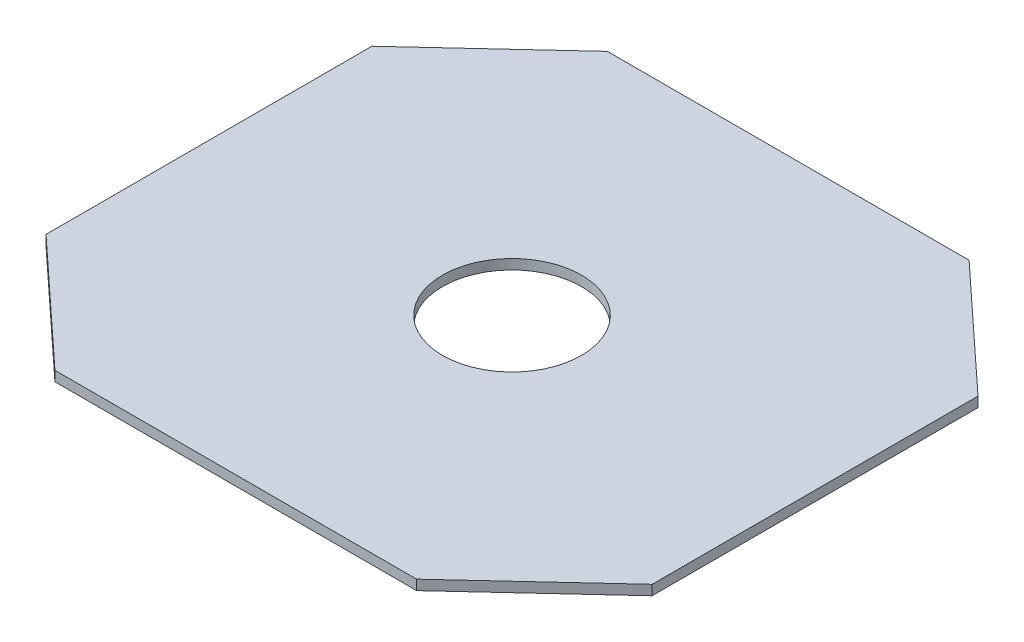
from build123d import *

# Parameters (mm, degrees)
SKETCH_1_R      = 35
EXTRUDE_1_DEPTH = 5


with BuildPart() as part:
    # Эскиз1 → Вытянуть1 (new body)
    with BuildSketch(Plane(origin=(0, 0, 0), x_dir=(1, 0, 0), z_dir=(0, 1, 0))):
        Polygon((-151.693051502, 77.916478726), (-151.693051502, -86.083521274), (-90.193051502, -143.083521274), (91.806948498, -143.083521274), (153.306948498, -86.083521274), (153.306948498, 77.916478726), (91.806948498, 134.916478726), (-90.193051502, 134.916478726), align=None)
        with Locations((0.806948498, -4.083521274)):
            Circle(SKETCH_1_R, mode=Mode.SUBTRACT)
    extrude(amount=EXTRUDE_1_DEPTH)


solid = part.part
